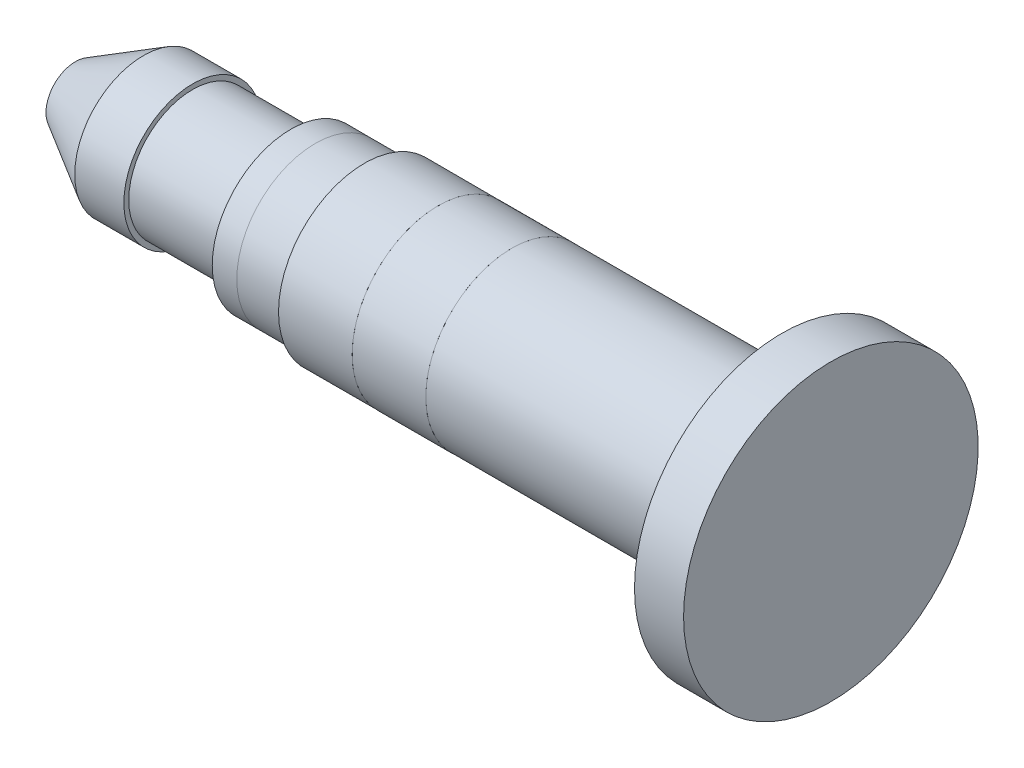
from build123d import *

# Parameters (mm, degrees)
FRACTIONNER1_START         = -10.5
FRACTIONNER1_OUTLINE_R     = 3
FRACTIONNER1_DEPTH         = 10.5
FRACTIONNER1_START_2       = -6.5
FRACTIONNER1_2_OUTLINE_R   = 1.75
FRACTIONNER1_2_DEPTH       = 6.5
FRACTIONNER1_START_3       = -1
FRACTIONNER1_3_OUTLINE_R   = 3
FRACTIONNER1_3_OUTLINE_R_2 = 1.75
FRACTIONNER1_3_DEPTH       = 1
FRACTIONNER1_START_4       = -8
FRACTIONNER1_4_OUTLINE_R   = 1.75
FRACTIONNER1_4_DEPTH       = 1.5
FRACTIONNER1_5_OUTLINE_R   = 1.6
FRACTIONNER1_5_DEPTH       = 2.5
FRACTIONNER1_START_5       = -9.5
FRACTIONNER1_6_OUTLINE_R   = 1.75
FRACTIONNER1_6_OUTLINE_R_2 = 1.6
FRACTIONNER1_6_DEPTH       = 1.5


# Read off the part's stored shape, not the designer's step: Fractionner1
with BuildPart() as part:
    # Esquisse1 → Révolution1 (revolve)
    with BuildSketch(Plane.XY, mode=Mode.PRIVATE) as r_volution1_sk:
        Polygon((-14, 1.4), (-15.385640646, 0.6), (-15.385640646, 0), (0, 0), (0, 3), (-1, 3), (-1, 1.75), (-9.5, 1.75), (-9.5, 1.6), (-11, 1.6), (-11, 1.3), (-13, 1.3), (-13, 1.4), align=None)
    revolve(r_volution1_sk.sketch.rotate(Axis((-28.897633393, 0, 0), (1, 0, 0)), 90), axis=Axis((-28.897633393, 0, 0), (1, 0, 0)))

    # Fractionner1 outline → Fractionner1 (cut)
    with BuildSketch(Plane.YZ.offset(FRACTIONNER1_START)):
        Circle(FRACTIONNER1_OUTLINE_R)
    extrude(amount=FRACTIONNER1_DEPTH, mode=Mode.SUBTRACT)


with BuildPart() as body_2:
    # Fractionner1 2 outline → Fractionner1 2 (new body)
    with BuildSketch(Plane.YZ.offset(FRACTIONNER1_START_2)):
        Circle(FRACTIONNER1_2_OUTLINE_R)
    extrude(amount=FRACTIONNER1_2_DEPTH)

    # Fractionner1 3 outline → Fractionner1 3 (add)
    with BuildSketch(Plane.YZ.offset(FRACTIONNER1_START_3)):
        Circle(FRACTIONNER1_3_OUTLINE_R)
        Circle(FRACTIONNER1_3_OUTLINE_R_2, mode=Mode.SUBTRACT)
    extrude(amount=FRACTIONNER1_3_DEPTH)


with BuildPart() as body_3:
    # Fractionner1 4 outline → Fractionner1 4 (new body)
    with BuildSketch(Plane.YZ.offset(FRACTIONNER1_START_4)):
        Circle(FRACTIONNER1_4_OUTLINE_R)
    extrude(amount=FRACTIONNER1_4_DEPTH)


with BuildPart() as body_4:
    # Fractionner1 5 outline → Fractionner1 5 (new body)
    with BuildSketch(Plane.YZ.offset(FRACTIONNER1_START)):
        Circle(FRACTIONNER1_5_OUTLINE_R)
    extrude(amount=FRACTIONNER1_5_DEPTH)

    # Fractionner1 6 outline → Fractionner1 6 (add)
    with BuildSketch(Plane.YZ.offset(FRACTIONNER1_START_5)):
        Circle(FRACTIONNER1_6_OUTLINE_R)
        Circle(FRACTIONNER1_6_OUTLINE_R_2, mode=Mode.SUBTRACT)
    extrude(amount=FRACTIONNER1_6_DEPTH)


solid = Compound([part.part, body_2.part, body_3.part, body_4.part])
